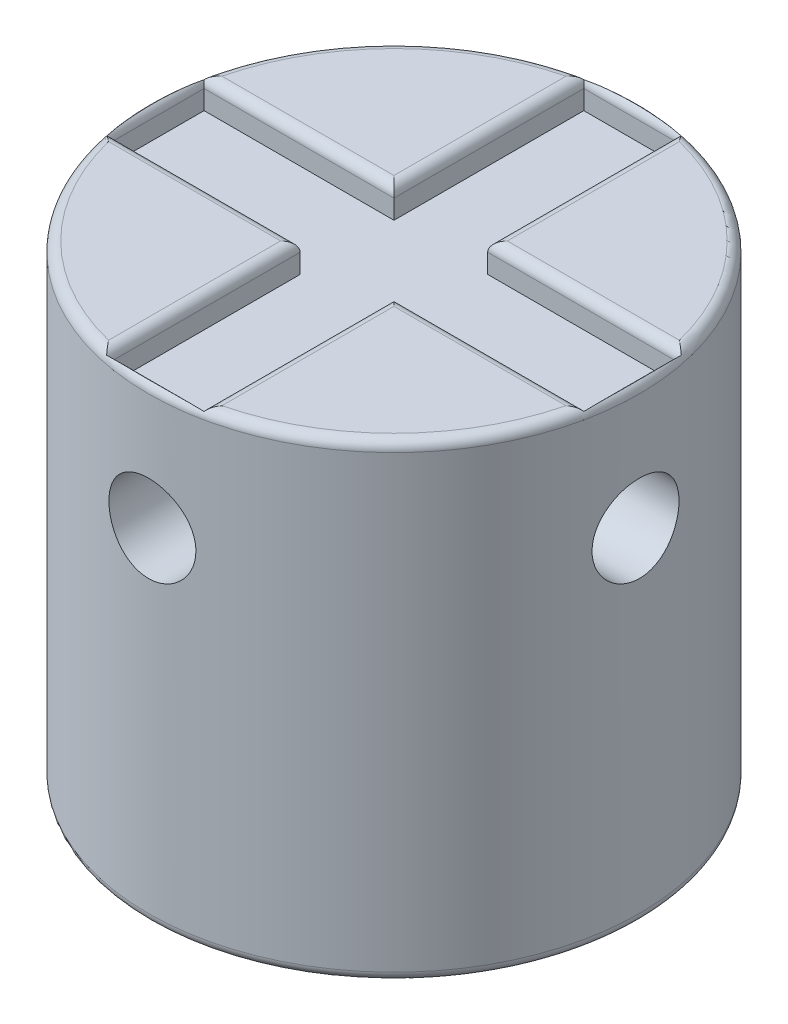
from build123d import *

# Parameters (mm, degrees)
SKETCH1_R               = 12.7
BOSS_EXTRUDE1_DEPTH     = 24.3000112
CUT_EXTRUDE1_DEPTH      = 31.217057175
CUT_EXTRUDE1_DEPTH_BACK = 31.217057175
SKETCH3_R               = 2.25
CUT_EXTRUDE2_DEPTH      = 31.21705734
CUT_EXTRUDE2_DEPTH_BACK = 31.21705734
SKETCH4_R               = 2.25
SKETCH6_W               = 9.825
SKETCH6_H               = 4.85
SKETCH6_W_2             = 4.85
SKETCH6_H_2             = 9.825
CUT_EXTRUDE4_DEPTH      = 1.5
SKETCH5_R               = 9.144
SKETCH5_R_2             = 7.3152
CUT_EXTRUDE3_DEPTH      = 2
FILLET1_R               = 0.508


with BuildPart() as part:
    # Sketch1 → Boss-Extrude1 (new body)
    with BuildSketch(Plane(origin=(0, 0, 0), x_dir=(1, 0, 0), z_dir=(0, 1, 0))):
        with Locations(Location((0, 0, 0), (0, 0, 270))):
            Circle(SKETCH1_R)
    extrude(amount=BOSS_EXTRUDE1_DEPTH)

    # Sketch3 → Cut-Extrude1 (cut, two sides: drawn at the far end of the back side and taken through both)
    with BuildSketch(Plane.XY.offset(-CUT_EXTRUDE1_DEPTH_BACK)):
        with Locations(Location((0, 17.7700056, 0), (0, 0, 90.000000003))):
            Circle(SKETCH3_R)
    extrude(amount=CUT_EXTRUDE1_DEPTH + CUT_EXTRUDE1_DEPTH_BACK, mode=Mode.SUBTRACT)

    # Sketch4 → Cut-Extrude2 (cut, two sides: drawn at the far end of the back side and taken through both)
    with BuildSketch(Plane(origin=(0, 0, 0), x_dir=(0, 0, -1), z_dir=(1, 0, 0)).offset(-CUT_EXTRUDE2_DEPTH_BACK)):
        with Locations((0, 17.7700056)):
            Circle(SKETCH4_R)
    extrude(amount=CUT_EXTRUDE2_DEPTH + CUT_EXTRUDE2_DEPTH_BACK, mode=Mode.SUBTRACT)

    # Sketch6 → Cut-Extrude4 (cut)
    with BuildSketch(Plane(origin=(0, 24.3000112, 0), x_dir=(1, 0, 0), z_dir=(0, 1, 0))):
        with Locations((-7.3375, 0)):
            Rectangle(SKETCH6_W, SKETCH6_H)
        Rectangle(SKETCH6_W_2, SKETCH6_H)
        with Locations((0, 7.3375)):
            Rectangle(SKETCH6_W_2, SKETCH6_H_2)
        with Locations((7.3375, 0)):
            Rectangle(SKETCH6_W, SKETCH6_H)
        with Locations((0, -7.3375)):
            Rectangle(SKETCH6_W_2, SKETCH6_H_2)
    extrude(amount=-CUT_EXTRUDE4_DEPTH, mode=Mode.SUBTRACT)

    # Sketch5 → Cut-Extrude3 (cut)
    with BuildSketch(Plane(origin=(-21.886226398, 0, 0), x_dir=(-1, 0, 0), z_dir=(0, 1, 0))):
        with Locations(Location((-21.886226398, 0, 0), (0, 0, 90))):
            Circle(SKETCH5_R)
        with Locations(Location((-21.886226398, 0, 0), (0, 0, 90))):
            Circle(SKETCH5_R_2, mode=Mode.SUBTRACT)
    extrude(amount=CUT_EXTRUDE3_DEPTH, mode=Mode.SUBTRACT)

    # Fillet1
    # the kernel refuses this fillet: 0.508 mm, written as the material it adds along each edge
    with BuildSketch(Plane(origin=(0, 2, 0), x_dir=(0, 0, 1), z_dir=(-1, 0, 0))) as fillet1_piece_1:
        with BuildLine():
            CenterArc((9.144 - FILLET1_R, -FILLET1_R), FILLET1_R, 0, 90)
            Line((9.144 - FILLET1_R, 0), (9.144 - FILLET1_R, FILLET1_R * 0.02))
            Line((9.144 - FILLET1_R, FILLET1_R * 0.02), (9.144 + FILLET1_R * 0.02, FILLET1_R * 0.02))
            Line((9.144 + FILLET1_R * 0.02, FILLET1_R * 0.02), (9.144 + FILLET1_R * 0.02, -FILLET1_R))
            Line((9.144 + FILLET1_R * 0.02, -FILLET1_R), (9.144, -FILLET1_R))
        make_face()
    revolve(axis=Axis((0, 2, 0), (0, 1, 0)))
    with BuildSketch(Plane(origin=(0, 2, 0), x_dir=(0, 0, 1), z_dir=(-1, 0, 0))) as fillet1_piece_2:
        with BuildLine():
            CenterArc((7.3152 + FILLET1_R, -FILLET1_R), FILLET1_R, 90, 90)
            Line((7.3152, -FILLET1_R), (7.3152 - FILLET1_R * 0.02, -FILLET1_R))
            Line((7.3152 - FILLET1_R * 0.02, -FILLET1_R), (7.3152 - FILLET1_R * 0.02, FILLET1_R * 0.02))
            Line((7.3152 - FILLET1_R * 0.02, FILLET1_R * 0.02), (7.3152 + FILLET1_R, FILLET1_R * 0.02))
            Line((7.3152 + FILLET1_R, FILLET1_R * 0.02), (7.3152 + FILLET1_R, 0))
        make_face()
    revolve(axis=Axis((0, 2, 0), (0, 1, 0)))
    # the kernel refuses this fillet: 0.508 mm, written as the material it takes off along each edge
    with BuildSketch(Plane(origin=(0, 0, 0), x_dir=(0, 0, 1), z_dir=(-1, 0, 0))) as fillet1_2_piece_1:
        with BuildLine():
            CenterArc((12.7 - FILLET1_R, FILLET1_R), FILLET1_R, 270, 90)
            Line((12.7 - FILLET1_R, 0), (12.7 - FILLET1_R, -FILLET1_R * 0.02))
            Line((12.7 - FILLET1_R, -FILLET1_R * 0.02), (12.7 + FILLET1_R * 0.02, -FILLET1_R * 0.02))
            Line((12.7 + FILLET1_R * 0.02, -FILLET1_R * 0.02), (12.7 + FILLET1_R * 0.02, FILLET1_R))
            Line((12.7 + FILLET1_R * 0.02, FILLET1_R), (12.7, FILLET1_R))
        make_face()
    revolve(axis=Axis((0, 0, 0), (0, 1, 0)), mode=Mode.SUBTRACT)
    with BuildSketch(Plane(origin=(-12.25, 24.3000112, -2.425), x_dir=(0, 0, -1), z_dir=(1, 0, 0))) as fillet1_2_piece_2:
        with BuildLine():
            CenterArc((FILLET1_R, -FILLET1_R), FILLET1_R, 90, 90)
            Line((0, -FILLET1_R), (-FILLET1_R * 0.02, -FILLET1_R))
            Line((-FILLET1_R * 0.02, -FILLET1_R), (-FILLET1_R * 0.02, FILLET1_R * 0.02))
            Line((-FILLET1_R * 0.02, FILLET1_R * 0.02), (FILLET1_R, FILLET1_R * 0.02))
            Line((FILLET1_R, FILLET1_R * 0.02), (FILLET1_R, 0))
        make_face()
    extrude(amount=9.825, mode=Mode.SUBTRACT)
    with BuildSketch(Plane(origin=(-2.425, 24.3000112, -12.25), x_dir=(-1, 0, 0), z_dir=(0, 0, 1)), Plane(origin=(12.25, 24.3000112, -2.425), x_dir=(0, 0, -1), z_dir=(-1, 0, 0)), Plane(origin=(-2.425, 24.3000112, 2.425), x_dir=(-1, 0, 0), z_dir=(0, 0, 1)), Plane(origin=(-12.25, 24.3000112, 2.425), x_dir=(0, 0, 1), z_dir=(1, 0, 0)), Plane(origin=(2.425, 24.3000112, 12.25), x_dir=(1, 0, 0), z_dir=(0, 0, -1)), Plane(origin=(2.425, 24.3000112, 2.425), x_dir=(0, 0, 1), z_dir=(1, 0, 0)), Plane(origin=(2.425, 24.3000112, -2.425), x_dir=(1, 0, 0), z_dir=(0, 0, -1))) as fillet1_2_piece_3:
        with BuildLine():
            CenterArc((FILLET1_R, FILLET1_R), FILLET1_R, 180, 90)
            Line((0, FILLET1_R), (-FILLET1_R * 0.02, FILLET1_R))
            Line((-FILLET1_R * 0.02, FILLET1_R), (-FILLET1_R * 0.02, -FILLET1_R * 0.02))
            Line((-FILLET1_R * 0.02, -FILLET1_R * 0.02), (FILLET1_R, -FILLET1_R * 0.02))
            Line((FILLET1_R, -FILLET1_R * 0.02), (FILLET1_R, 0))
        make_face()
    extrude(amount=9.825, mode=Mode.SUBTRACT)
    with BuildSketch(Plane(origin=(2.425, 24.3000112, -12.25), x_dir=(0, 0, -1), z_dir=(-1, 0, 0)), Plane(origin=(12.25, 24.3000112, 2.425), x_dir=(1, 0, 0), z_dir=(0, 0, -1)), Plane(origin=(-12.25, 24.3000112, -2.425), x_dir=(-1, 0, 0), z_dir=(0, 0, 1)), Plane(origin=(-2.425, 24.3000112, 12.25), x_dir=(0, 0, 1), z_dir=(1, 0, 0))) as fillet1_2_piece_4:
        with BuildLine():
            CenterArc((FILLET1_R, FILLET1_R), FILLET1_R, 180, 90)
            Line((0, FILLET1_R), (-FILLET1_R * 0.02, FILLET1_R))
            Line((-FILLET1_R * 0.02, FILLET1_R), (-FILLET1_R * 0.02, -FILLET1_R * 0.02))
            Line((-FILLET1_R * 0.02, -FILLET1_R * 0.02), (FILLET1_R, -FILLET1_R * 0.02))
            Line((FILLET1_R, -FILLET1_R * 0.02), (FILLET1_R, 0))
        make_face()
    extrude(amount=4.85, mode=Mode.SUBTRACT)
    with BuildSketch(Plane(origin=(0, 24.3000112, 0), x_dir=(0, 0, 1), z_dir=(-1, 0, 0))) as fillet1_2_piece_5:
        with BuildLine():
            CenterArc((12.7 - FILLET1_R, -FILLET1_R), FILLET1_R, 0, 90)
            Line((12.7 - FILLET1_R, 0), (12.7 - FILLET1_R, FILLET1_R * 0.02))
            Line((12.7 - FILLET1_R, FILLET1_R * 0.02), (12.7 + FILLET1_R * 0.02, FILLET1_R * 0.02))
            Line((12.7 + FILLET1_R * 0.02, FILLET1_R * 0.02), (12.7 + FILLET1_R * 0.02, -FILLET1_R))
            Line((12.7 + FILLET1_R * 0.02, -FILLET1_R), (12.7, -FILLET1_R))
        make_face()
    revolve(axis=Axis((0, 24.3000112, 0), (0, 1, 0)), mode=Mode.SUBTRACT)
    with BuildSketch(Plane(origin=(0, 0, 0), x_dir=(0, 0, 1), z_dir=(-1, 0, 0))) as fillet1_2_piece_6:
        with BuildLine():
            CenterArc((7.3152 - FILLET1_R, FILLET1_R), FILLET1_R, 270, 90)
            Line((7.3152 - FILLET1_R, 0), (7.3152 - FILLET1_R, -FILLET1_R * 0.02))
            Line((7.3152 - FILLET1_R, -FILLET1_R * 0.02), (7.3152 + FILLET1_R * 0.02, -FILLET1_R * 0.02))
            Line((7.3152 + FILLET1_R * 0.02, -FILLET1_R * 0.02), (7.3152 + FILLET1_R * 0.02, FILLET1_R))
            Line((7.3152 + FILLET1_R * 0.02, FILLET1_R), (7.3152, FILLET1_R))
        make_face()
    revolve(axis=Axis((0, 0, 0), (0, 1, 0)), mode=Mode.SUBTRACT)
    with BuildSketch(Plane(origin=(0, 0, 0), x_dir=(0, 0, 1), z_dir=(-1, 0, 0))) as fillet1_2_piece_7:
        with BuildLine():
            CenterArc((9.144 + FILLET1_R, FILLET1_R), FILLET1_R, 180, 90)
            Line((9.144, FILLET1_R), (9.144 - FILLET1_R * 0.02, FILLET1_R))
            Line((9.144 - FILLET1_R * 0.02, FILLET1_R), (9.144 - FILLET1_R * 0.02, -FILLET1_R * 0.02))
            Line((9.144 - FILLET1_R * 0.02, -FILLET1_R * 0.02), (9.144 + FILLET1_R, -FILLET1_R * 0.02))
            Line((9.144 + FILLET1_R, -FILLET1_R * 0.02), (9.144 + FILLET1_R, 0))
        make_face()
    revolve(axis=Axis((0, 0, 0), (0, 1, 0)), mode=Mode.SUBTRACT)
    with BuildSketch(Plane(origin=(-12.25, 24.3000112, -3.695), x_dir=(-1, 0, 0), z_dir=(0, 0, 1))) as fillet1_2_piece_8a_section:
        with BuildLine():
            CenterArc((FILLET1_R, FILLET1_R), FILLET1_R, 180, 90)
            Line((0, FILLET1_R), (-FILLET1_R * 0.02, FILLET1_R))
            Line((-FILLET1_R * 0.02, FILLET1_R), (-FILLET1_R * 0.02, -FILLET1_R * 0.02))
            Line((-FILLET1_R * 0.02, -FILLET1_R * 0.02), (FILLET1_R, -FILLET1_R * 0.02))
            Line((FILLET1_R, -FILLET1_R * 0.02), (FILLET1_R, 0))
        make_face()
    fillet1_2_piece_8a = extrude(amount=6.12, mode=Mode.PRIVATE)
    fillet1_2_piece_8a = split(fillet1_2_piece_8a, bisect_by=Plane(origin=(-12.365008718, 24.185002482, -2.425), z_dir=(0, 0, -1)), keep=Keep.TOP, mode=Mode.PRIVATE)
    with BuildSketch(Plane(origin=(-13.52, 24.3000112, -2.425), x_dir=(0, 0, -1), z_dir=(1, 0, 0))) as fillet1_2_piece_8b_section:
        with BuildLine():
            CenterArc((FILLET1_R, -FILLET1_R), FILLET1_R, 90, 90)
            Line((0, -FILLET1_R), (-FILLET1_R * 0.02, -FILLET1_R))
            Line((-FILLET1_R * 0.02, -FILLET1_R), (-FILLET1_R * 0.02, FILLET1_R * 0.02))
            Line((-FILLET1_R * 0.02, FILLET1_R * 0.02), (FILLET1_R, FILLET1_R * 0.02))
            Line((FILLET1_R, FILLET1_R * 0.02), (FILLET1_R, 0))
        make_face()
    fillet1_2_piece_8b = extrude(amount=11.095, mode=Mode.PRIVATE)
    fillet1_2_piece_8b = split(fillet1_2_piece_8b, bisect_by=Plane(origin=(-12.25, 24.185002482, -2.540008718), z_dir=(-1, 0, 0)), keep=Keep.TOP, mode=Mode.PRIVATE)
    fillet1_2_piece_8 = fillet1_2_piece_8a & fillet1_2_piece_8b
    add(fillet1_2_piece_8, mode=Mode.SUBTRACT)
    with BuildSketch(Plane(origin=(-2.425, 24.3000112, -12.25), x_dir=(-1, 0, 0), z_dir=(0, 0, 1))) as fillet1_2_piece_9a_section:
        with BuildLine():
            CenterArc((FILLET1_R, FILLET1_R), FILLET1_R, 180, 90)
            Line((0, FILLET1_R), (-FILLET1_R * 0.02, FILLET1_R))
            Line((-FILLET1_R * 0.02, FILLET1_R), (-FILLET1_R * 0.02, -FILLET1_R * 0.02))
            Line((-FILLET1_R * 0.02, -FILLET1_R * 0.02), (FILLET1_R, -FILLET1_R * 0.02))
            Line((FILLET1_R, -FILLET1_R * 0.02), (FILLET1_R, 0))
        make_face()
    fillet1_2_piece_9a = extrude(amount=11.095, mode=Mode.PRIVATE)
    fillet1_2_piece_9a = split(fillet1_2_piece_9a, bisect_by=Plane(origin=(-2.540008718, 24.185002482, -2.425), z_dir=(0, 0, 1)), keep=Keep.TOP, mode=Mode.PRIVATE)
    with BuildSketch(Plane(origin=(-12.25, 24.3000112, -2.425), x_dir=(0, 0, -1), z_dir=(1, 0, 0))) as fillet1_2_piece_9b_section:
        with BuildLine():
            CenterArc((FILLET1_R, -FILLET1_R), FILLET1_R, 90, 90)
            Line((0, -FILLET1_R), (-FILLET1_R * 0.02, -FILLET1_R))
            Line((-FILLET1_R * 0.02, -FILLET1_R), (-FILLET1_R * 0.02, FILLET1_R * 0.02))
            Line((-FILLET1_R * 0.02, FILLET1_R * 0.02), (FILLET1_R, FILLET1_R * 0.02))
            Line((FILLET1_R, FILLET1_R * 0.02), (FILLET1_R, 0))
        make_face()
    fillet1_2_piece_9b = extrude(amount=11.095, mode=Mode.PRIVATE)
    fillet1_2_piece_9b = split(fillet1_2_piece_9b, bisect_by=Plane(origin=(-2.425, 24.185002482, -2.540008718), z_dir=(1, 0, 0)), keep=Keep.TOP, mode=Mode.PRIVATE)
    fillet1_2_piece_9 = fillet1_2_piece_9a & fillet1_2_piece_9b
    add(fillet1_2_piece_9, mode=Mode.SUBTRACT)
    with BuildSketch(Plane(origin=(2.425, 24.3000112, -12.25), x_dir=(0, 0, -1), z_dir=(-1, 0, 0))) as fillet1_2_piece_10a_section:
        with BuildLine():
            CenterArc((FILLET1_R, FILLET1_R), FILLET1_R, 180, 90)
            Line((0, FILLET1_R), (-FILLET1_R * 0.02, FILLET1_R))
            Line((-FILLET1_R * 0.02, FILLET1_R), (-FILLET1_R * 0.02, -FILLET1_R * 0.02))
            Line((-FILLET1_R * 0.02, -FILLET1_R * 0.02), (FILLET1_R, -FILLET1_R * 0.02))
            Line((FILLET1_R, -FILLET1_R * 0.02), (FILLET1_R, 0))
        make_face()
    fillet1_2_piece_10a = extrude(amount=6.12, mode=Mode.PRIVATE)
    fillet1_2_piece_10a = split(fillet1_2_piece_10a, bisect_by=Plane(origin=(-2.425, 24.185002482, -12.365008718), z_dir=(-1, 0, 0)), keep=Keep.TOP, mode=Mode.PRIVATE)
    with BuildSketch(Plane(origin=(-2.425, 24.3000112, -13.52), x_dir=(-1, 0, 0), z_dir=(0, 0, 1))) as fillet1_2_piece_10b_section:
        with BuildLine():
            CenterArc((FILLET1_R, FILLET1_R), FILLET1_R, 180, 90)
            Line((0, FILLET1_R), (-FILLET1_R * 0.02, FILLET1_R))
            Line((-FILLET1_R * 0.02, FILLET1_R), (-FILLET1_R * 0.02, -FILLET1_R * 0.02))
            Line((-FILLET1_R * 0.02, -FILLET1_R * 0.02), (FILLET1_R, -FILLET1_R * 0.02))
            Line((FILLET1_R, -FILLET1_R * 0.02), (FILLET1_R, 0))
        make_face()
    fillet1_2_piece_10b = extrude(amount=11.095, mode=Mode.PRIVATE)
    fillet1_2_piece_10b = split(fillet1_2_piece_10b, bisect_by=Plane(origin=(-2.540008718, 24.185002482, -12.25), z_dir=(0, 0, -1)), keep=Keep.TOP, mode=Mode.PRIVATE)
    fillet1_2_piece_10 = fillet1_2_piece_10a & fillet1_2_piece_10b
    add(fillet1_2_piece_10, mode=Mode.SUBTRACT)
    with BuildSketch(Plane(origin=(2.425, 24.3000112, -2.425), x_dir=(1, 0, 0), z_dir=(0, 0, -1))) as fillet1_2_piece_11a_section:
        with BuildLine():
            CenterArc((FILLET1_R, FILLET1_R), FILLET1_R, 180, 90)
            Line((0, FILLET1_R), (-FILLET1_R * 0.02, FILLET1_R))
            Line((-FILLET1_R * 0.02, FILLET1_R), (-FILLET1_R * 0.02, -FILLET1_R * 0.02))
            Line((-FILLET1_R * 0.02, -FILLET1_R * 0.02), (FILLET1_R, -FILLET1_R * 0.02))
            Line((FILLET1_R, -FILLET1_R * 0.02), (FILLET1_R, 0))
        make_face()
    fillet1_2_piece_11a = extrude(amount=11.095, mode=Mode.PRIVATE)
    fillet1_2_piece_11a = split(fillet1_2_piece_11a, bisect_by=Plane(origin=(2.540008718, 24.185002482, -12.25), z_dir=(0, 0, -1)), keep=Keep.TOP, mode=Mode.PRIVATE)
    with BuildSketch(Plane(origin=(3.695, 24.3000112, -12.25), x_dir=(0, 0, -1), z_dir=(-1, 0, 0))) as fillet1_2_piece_11b_section:
        with BuildLine():
            CenterArc((FILLET1_R, FILLET1_R), FILLET1_R, 180, 90)
            Line((0, FILLET1_R), (-FILLET1_R * 0.02, FILLET1_R))
            Line((-FILLET1_R * 0.02, FILLET1_R), (-FILLET1_R * 0.02, -FILLET1_R * 0.02))
            Line((-FILLET1_R * 0.02, -FILLET1_R * 0.02), (FILLET1_R, -FILLET1_R * 0.02))
            Line((FILLET1_R, -FILLET1_R * 0.02), (FILLET1_R, 0))
        make_face()
    fillet1_2_piece_11b = extrude(amount=6.12, mode=Mode.PRIVATE)
    fillet1_2_piece_11b = split(fillet1_2_piece_11b, bisect_by=Plane(origin=(2.425, 24.185002482, -12.365008718), z_dir=(1, 0, 0)), keep=Keep.TOP, mode=Mode.PRIVATE)
    fillet1_2_piece_11 = fillet1_2_piece_11a & fillet1_2_piece_11b
    add(fillet1_2_piece_11, mode=Mode.SUBTRACT)
    with BuildSketch(Plane(origin=(12.25, 24.3000112, 2.425), x_dir=(1, 0, 0), z_dir=(0, 0, -1))) as fillet1_2_piece_12a_section:
        with BuildLine():
            CenterArc((FILLET1_R, FILLET1_R), FILLET1_R, 180, 90)
            Line((0, FILLET1_R), (-FILLET1_R * 0.02, FILLET1_R))
            Line((-FILLET1_R * 0.02, FILLET1_R), (-FILLET1_R * 0.02, -FILLET1_R * 0.02))
            Line((-FILLET1_R * 0.02, -FILLET1_R * 0.02), (FILLET1_R, -FILLET1_R * 0.02))
            Line((FILLET1_R, -FILLET1_R * 0.02), (FILLET1_R, 0))
        make_face()
    fillet1_2_piece_12a = extrude(amount=6.12, mode=Mode.PRIVATE)
    fillet1_2_piece_12a = split(fillet1_2_piece_12a, bisect_by=Plane(origin=(12.365008718, 24.185002482, -2.425), z_dir=(0, 0, -1)), keep=Keep.TOP, mode=Mode.PRIVATE)
    with BuildSketch(Plane(origin=(13.52, 24.3000112, -2.425), x_dir=(0, 0, -1), z_dir=(-1, 0, 0))) as fillet1_2_piece_12b_section:
        with BuildLine():
            CenterArc((FILLET1_R, FILLET1_R), FILLET1_R, 180, 90)
            Line((0, FILLET1_R), (-FILLET1_R * 0.02, FILLET1_R))
            Line((-FILLET1_R * 0.02, FILLET1_R), (-FILLET1_R * 0.02, -FILLET1_R * 0.02))
            Line((-FILLET1_R * 0.02, -FILLET1_R * 0.02), (FILLET1_R, -FILLET1_R * 0.02))
            Line((FILLET1_R, -FILLET1_R * 0.02), (FILLET1_R, 0))
        make_face()
    fillet1_2_piece_12b = extrude(amount=11.095, mode=Mode.PRIVATE)
    fillet1_2_piece_12b = split(fillet1_2_piece_12b, bisect_by=Plane(origin=(12.25, 24.185002482, -2.540008718), z_dir=(1, 0, 0)), keep=Keep.TOP, mode=Mode.PRIVATE)
    fillet1_2_piece_12 = fillet1_2_piece_12a & fillet1_2_piece_12b
    add(fillet1_2_piece_12, mode=Mode.SUBTRACT)
    with BuildSketch(Plane(origin=(12.25, 24.3000112, -2.425), x_dir=(0, 0, -1), z_dir=(-1, 0, 0))) as fillet1_2_piece_13a_section:
        with BuildLine():
            CenterArc((FILLET1_R, FILLET1_R), FILLET1_R, 180, 90)
            Line((0, FILLET1_R), (-FILLET1_R * 0.02, FILLET1_R))
            Line((-FILLET1_R * 0.02, FILLET1_R), (-FILLET1_R * 0.02, -FILLET1_R * 0.02))
            Line((-FILLET1_R * 0.02, -FILLET1_R * 0.02), (FILLET1_R, -FILLET1_R * 0.02))
            Line((FILLET1_R, -FILLET1_R * 0.02), (FILLET1_R, 0))
        make_face()
    fillet1_2_piece_13a = extrude(amount=11.095, mode=Mode.PRIVATE)
    fillet1_2_piece_13a = split(fillet1_2_piece_13a, bisect_by=Plane(origin=(2.425, 24.185002482, -2.540008718), z_dir=(-1, 0, 0)), keep=Keep.TOP, mode=Mode.PRIVATE)
    with BuildSketch(Plane(origin=(2.425, 24.3000112, -1.155), x_dir=(1, 0, 0), z_dir=(0, 0, -1))) as fillet1_2_piece_13b_section:
        with BuildLine():
            CenterArc((FILLET1_R, FILLET1_R), FILLET1_R, 180, 90)
            Line((0, FILLET1_R), (-FILLET1_R * 0.02, FILLET1_R))
            Line((-FILLET1_R * 0.02, FILLET1_R), (-FILLET1_R * 0.02, -FILLET1_R * 0.02))
            Line((-FILLET1_R * 0.02, -FILLET1_R * 0.02), (FILLET1_R, -FILLET1_R * 0.02))
            Line((FILLET1_R, -FILLET1_R * 0.02), (FILLET1_R, 0))
        make_face()
    fillet1_2_piece_13b = extrude(amount=11.095, mode=Mode.PRIVATE)
    fillet1_2_piece_13b = split(fillet1_2_piece_13b, bisect_by=Plane(origin=(2.540008718, 24.185002482, -2.425), z_dir=(0, 0, 1)), keep=Keep.TOP, mode=Mode.PRIVATE)
    fillet1_2_piece_13 = fillet1_2_piece_13a & fillet1_2_piece_13b
    add(fillet1_2_piece_13, mode=Mode.SUBTRACT)
    with BuildSketch(Plane(origin=(2.425, 24.3000112, 2.425), x_dir=(0, 0, 1), z_dir=(1, 0, 0))) as fillet1_2_piece_14a_section:
        with BuildLine():
            CenterArc((FILLET1_R, FILLET1_R), FILLET1_R, 180, 90)
            Line((0, FILLET1_R), (-FILLET1_R * 0.02, FILLET1_R))
            Line((-FILLET1_R * 0.02, FILLET1_R), (-FILLET1_R * 0.02, -FILLET1_R * 0.02))
            Line((-FILLET1_R * 0.02, -FILLET1_R * 0.02), (FILLET1_R, -FILLET1_R * 0.02))
            Line((FILLET1_R, -FILLET1_R * 0.02), (FILLET1_R, 0))
        make_face()
    fillet1_2_piece_14a = extrude(amount=11.095, mode=Mode.PRIVATE)
    fillet1_2_piece_14a = split(fillet1_2_piece_14a, bisect_by=Plane(origin=(12.25, 24.185002482, 2.540008718), z_dir=(1, 0, 0)), keep=Keep.TOP, mode=Mode.PRIVATE)
    with BuildSketch(Plane(origin=(12.25, 24.3000112, 3.695), x_dir=(1, 0, 0), z_dir=(0, 0, -1))) as fillet1_2_piece_14b_section:
        with BuildLine():
            CenterArc((FILLET1_R, FILLET1_R), FILLET1_R, 180, 90)
            Line((0, FILLET1_R), (-FILLET1_R * 0.02, FILLET1_R))
            Line((-FILLET1_R * 0.02, FILLET1_R), (-FILLET1_R * 0.02, -FILLET1_R * 0.02))
            Line((-FILLET1_R * 0.02, -FILLET1_R * 0.02), (FILLET1_R, -FILLET1_R * 0.02))
            Line((FILLET1_R, -FILLET1_R * 0.02), (FILLET1_R, 0))
        make_face()
    fillet1_2_piece_14b = extrude(amount=6.12, mode=Mode.PRIVATE)
    fillet1_2_piece_14b = split(fillet1_2_piece_14b, bisect_by=Plane(origin=(12.365008718, 24.185002482, 2.425), z_dir=(0, 0, 1)), keep=Keep.TOP, mode=Mode.PRIVATE)
    fillet1_2_piece_14 = fillet1_2_piece_14a & fillet1_2_piece_14b
    add(fillet1_2_piece_14, mode=Mode.SUBTRACT)
    with BuildSketch(Plane(origin=(-12.25, 24.3000112, 2.425), x_dir=(0, 0, 1), z_dir=(1, 0, 0))) as fillet1_2_piece_15a_section:
        with BuildLine():
            CenterArc((FILLET1_R, FILLET1_R), FILLET1_R, 180, 90)
            Line((0, FILLET1_R), (-FILLET1_R * 0.02, FILLET1_R))
            Line((-FILLET1_R * 0.02, FILLET1_R), (-FILLET1_R * 0.02, -FILLET1_R * 0.02))
            Line((-FILLET1_R * 0.02, -FILLET1_R * 0.02), (FILLET1_R, -FILLET1_R * 0.02))
            Line((FILLET1_R, -FILLET1_R * 0.02), (FILLET1_R, 0))
        make_face()
    fillet1_2_piece_15a = extrude(amount=11.095, mode=Mode.PRIVATE)
    fillet1_2_piece_15a = split(fillet1_2_piece_15a, bisect_by=Plane(origin=(-2.425, 24.185002482, 2.540008718), z_dir=(1, 0, 0)), keep=Keep.TOP, mode=Mode.PRIVATE)
    with BuildSketch(Plane(origin=(-2.425, 24.3000112, 1.155), x_dir=(-1, 0, 0), z_dir=(0, 0, 1))) as fillet1_2_piece_15b_section:
        with BuildLine():
            CenterArc((FILLET1_R, FILLET1_R), FILLET1_R, 180, 90)
            Line((0, FILLET1_R), (-FILLET1_R * 0.02, FILLET1_R))
            Line((-FILLET1_R * 0.02, FILLET1_R), (-FILLET1_R * 0.02, -FILLET1_R * 0.02))
            Line((-FILLET1_R * 0.02, -FILLET1_R * 0.02), (FILLET1_R, -FILLET1_R * 0.02))
            Line((FILLET1_R, -FILLET1_R * 0.02), (FILLET1_R, 0))
        make_face()
    fillet1_2_piece_15b = extrude(amount=11.095, mode=Mode.PRIVATE)
    fillet1_2_piece_15b = split(fillet1_2_piece_15b, bisect_by=Plane(origin=(-2.540008718, 24.185002482, 2.425), z_dir=(0, 0, -1)), keep=Keep.TOP, mode=Mode.PRIVATE)
    fillet1_2_piece_15 = fillet1_2_piece_15a & fillet1_2_piece_15b
    add(fillet1_2_piece_15, mode=Mode.SUBTRACT)
    with BuildSketch(Plane(origin=(-2.425, 24.3000112, 2.425), x_dir=(-1, 0, 0), z_dir=(0, 0, 1))) as fillet1_2_piece_16a_section:
        with BuildLine():
            CenterArc((FILLET1_R, FILLET1_R), FILLET1_R, 180, 90)
            Line((0, FILLET1_R), (-FILLET1_R * 0.02, FILLET1_R))
            Line((-FILLET1_R * 0.02, FILLET1_R), (-FILLET1_R * 0.02, -FILLET1_R * 0.02))
            Line((-FILLET1_R * 0.02, -FILLET1_R * 0.02), (FILLET1_R, -FILLET1_R * 0.02))
            Line((FILLET1_R, -FILLET1_R * 0.02), (FILLET1_R, 0))
        make_face()
    fillet1_2_piece_16a = extrude(amount=11.095, mode=Mode.PRIVATE)
    fillet1_2_piece_16a = split(fillet1_2_piece_16a, bisect_by=Plane(origin=(-2.540008718, 24.185002482, 12.25), z_dir=(0, 0, 1)), keep=Keep.TOP, mode=Mode.PRIVATE)
    with BuildSketch(Plane(origin=(-3.695, 24.3000112, 12.25), x_dir=(0, 0, 1), z_dir=(1, 0, 0))) as fillet1_2_piece_16b_section:
        with BuildLine():
            CenterArc((FILLET1_R, FILLET1_R), FILLET1_R, 180, 90)
            Line((0, FILLET1_R), (-FILLET1_R * 0.02, FILLET1_R))
            Line((-FILLET1_R * 0.02, FILLET1_R), (-FILLET1_R * 0.02, -FILLET1_R * 0.02))
            Line((-FILLET1_R * 0.02, -FILLET1_R * 0.02), (FILLET1_R, -FILLET1_R * 0.02))
            Line((FILLET1_R, -FILLET1_R * 0.02), (FILLET1_R, 0))
        make_face()
    fillet1_2_piece_16b = extrude(amount=6.12, mode=Mode.PRIVATE)
    fillet1_2_piece_16b = split(fillet1_2_piece_16b, bisect_by=Plane(origin=(-2.425, 24.185002482, 12.365008718), z_dir=(-1, 0, 0)), keep=Keep.TOP, mode=Mode.PRIVATE)
    fillet1_2_piece_16 = fillet1_2_piece_16a & fillet1_2_piece_16b
    add(fillet1_2_piece_16, mode=Mode.SUBTRACT)
    with BuildSketch(Plane(origin=(-12.25, 24.3000112, -2.425), x_dir=(-1, 0, 0), z_dir=(0, 0, 1))) as fillet1_2_piece_17a_section:
        with BuildLine():
            CenterArc((FILLET1_R, FILLET1_R), FILLET1_R, 180, 90)
            Line((0, FILLET1_R), (-FILLET1_R * 0.02, FILLET1_R))
            Line((-FILLET1_R * 0.02, FILLET1_R), (-FILLET1_R * 0.02, -FILLET1_R * 0.02))
            Line((-FILLET1_R * 0.02, -FILLET1_R * 0.02), (FILLET1_R, -FILLET1_R * 0.02))
            Line((FILLET1_R, -FILLET1_R * 0.02), (FILLET1_R, 0))
        make_face()
    fillet1_2_piece_17a = extrude(amount=6.12, mode=Mode.PRIVATE)
    fillet1_2_piece_17a = split(fillet1_2_piece_17a, bisect_by=Plane(origin=(-12.365008718, 24.185002482, 2.425), z_dir=(0, 0, 1)), keep=Keep.TOP, mode=Mode.PRIVATE)
    with BuildSketch(Plane(origin=(-13.52, 24.3000112, 2.425), x_dir=(0, 0, 1), z_dir=(1, 0, 0))) as fillet1_2_piece_17b_section:
        with BuildLine():
            CenterArc((FILLET1_R, FILLET1_R), FILLET1_R, 180, 90)
            Line((0, FILLET1_R), (-FILLET1_R * 0.02, FILLET1_R))
            Line((-FILLET1_R * 0.02, FILLET1_R), (-FILLET1_R * 0.02, -FILLET1_R * 0.02))
            Line((-FILLET1_R * 0.02, -FILLET1_R * 0.02), (FILLET1_R, -FILLET1_R * 0.02))
            Line((FILLET1_R, -FILLET1_R * 0.02), (FILLET1_R, 0))
        make_face()
    fillet1_2_piece_17b = extrude(amount=11.095, mode=Mode.PRIVATE)
    fillet1_2_piece_17b = split(fillet1_2_piece_17b, bisect_by=Plane(origin=(-12.25, 24.185002482, 2.540008718), z_dir=(-1, 0, 0)), keep=Keep.TOP, mode=Mode.PRIVATE)
    fillet1_2_piece_17 = fillet1_2_piece_17a & fillet1_2_piece_17b
    add(fillet1_2_piece_17, mode=Mode.SUBTRACT)
    with BuildSketch(Plane(origin=(-2.425, 24.3000112, 12.25), x_dir=(0, 0, 1), z_dir=(1, 0, 0))) as fillet1_2_piece_18a_section:
        with BuildLine():
            CenterArc((FILLET1_R, FILLET1_R), FILLET1_R, 180, 90)
            Line((0, FILLET1_R), (-FILLET1_R * 0.02, FILLET1_R))
            Line((-FILLET1_R * 0.02, FILLET1_R), (-FILLET1_R * 0.02, -FILLET1_R * 0.02))
            Line((-FILLET1_R * 0.02, -FILLET1_R * 0.02), (FILLET1_R, -FILLET1_R * 0.02))
            Line((FILLET1_R, -FILLET1_R * 0.02), (FILLET1_R, 0))
        make_face()
    fillet1_2_piece_18a = extrude(amount=6.12, mode=Mode.PRIVATE)
    fillet1_2_piece_18a = split(fillet1_2_piece_18a, bisect_by=Plane(origin=(2.425, 24.185002482, 12.365008718), z_dir=(1, 0, 0)), keep=Keep.TOP, mode=Mode.PRIVATE)
    with BuildSketch(Plane(origin=(2.425, 24.3000112, 13.52), x_dir=(1, 0, 0), z_dir=(0, 0, -1))) as fillet1_2_piece_18b_section:
        with BuildLine():
            CenterArc((FILLET1_R, FILLET1_R), FILLET1_R, 180, 90)
            Line((0, FILLET1_R), (-FILLET1_R * 0.02, FILLET1_R))
            Line((-FILLET1_R * 0.02, FILLET1_R), (-FILLET1_R * 0.02, -FILLET1_R * 0.02))
            Line((-FILLET1_R * 0.02, -FILLET1_R * 0.02), (FILLET1_R, -FILLET1_R * 0.02))
            Line((FILLET1_R, -FILLET1_R * 0.02), (FILLET1_R, 0))
        make_face()
    fillet1_2_piece_18b = extrude(amount=11.095, mode=Mode.PRIVATE)
    fillet1_2_piece_18b = split(fillet1_2_piece_18b, bisect_by=Plane(origin=(2.540008718, 24.185002482, 12.25), z_dir=(0, 0, 1)), keep=Keep.TOP, mode=Mode.PRIVATE)
    fillet1_2_piece_18 = fillet1_2_piece_18a & fillet1_2_piece_18b
    add(fillet1_2_piece_18, mode=Mode.SUBTRACT)
    with BuildSketch(Plane(origin=(2.425, 24.3000112, 12.25), x_dir=(1, 0, 0), z_dir=(0, 0, -1))) as fillet1_2_piece_19a_section:
        with BuildLine():
            CenterArc((FILLET1_R, FILLET1_R), FILLET1_R, 180, 90)
            Line((0, FILLET1_R), (-FILLET1_R * 0.02, FILLET1_R))
            Line((-FILLET1_R * 0.02, FILLET1_R), (-FILLET1_R * 0.02, -FILLET1_R * 0.02))
            Line((-FILLET1_R * 0.02, -FILLET1_R * 0.02), (FILLET1_R, -FILLET1_R * 0.02))
            Line((FILLET1_R, -FILLET1_R * 0.02), (FILLET1_R, 0))
        make_face()
    fillet1_2_piece_19a = extrude(amount=11.095, mode=Mode.PRIVATE)
    fillet1_2_piece_19a = split(fillet1_2_piece_19a, bisect_by=Plane(origin=(2.540008718, 24.185002482, 2.425), z_dir=(0, 0, -1)), keep=Keep.TOP, mode=Mode.PRIVATE)
    with BuildSketch(Plane(origin=(1.155, 24.3000112, 2.425), x_dir=(0, 0, 1), z_dir=(1, 0, 0))) as fillet1_2_piece_19b_section:
        with BuildLine():
            CenterArc((FILLET1_R, FILLET1_R), FILLET1_R, 180, 90)
            Line((0, FILLET1_R), (-FILLET1_R * 0.02, FILLET1_R))
            Line((-FILLET1_R * 0.02, FILLET1_R), (-FILLET1_R * 0.02, -FILLET1_R * 0.02))
            Line((-FILLET1_R * 0.02, -FILLET1_R * 0.02), (FILLET1_R, -FILLET1_R * 0.02))
            Line((FILLET1_R, -FILLET1_R * 0.02), (FILLET1_R, 0))
        make_face()
    fillet1_2_piece_19b = extrude(amount=11.095, mode=Mode.PRIVATE)
    fillet1_2_piece_19b = split(fillet1_2_piece_19b, bisect_by=Plane(origin=(2.425, 24.185002482, 2.540008718), z_dir=(-1, 0, 0)), keep=Keep.TOP, mode=Mode.PRIVATE)
    fillet1_2_piece_19 = fillet1_2_piece_19a & fillet1_2_piece_19b
    add(fillet1_2_piece_19, mode=Mode.SUBTRACT)


solid = part.part
